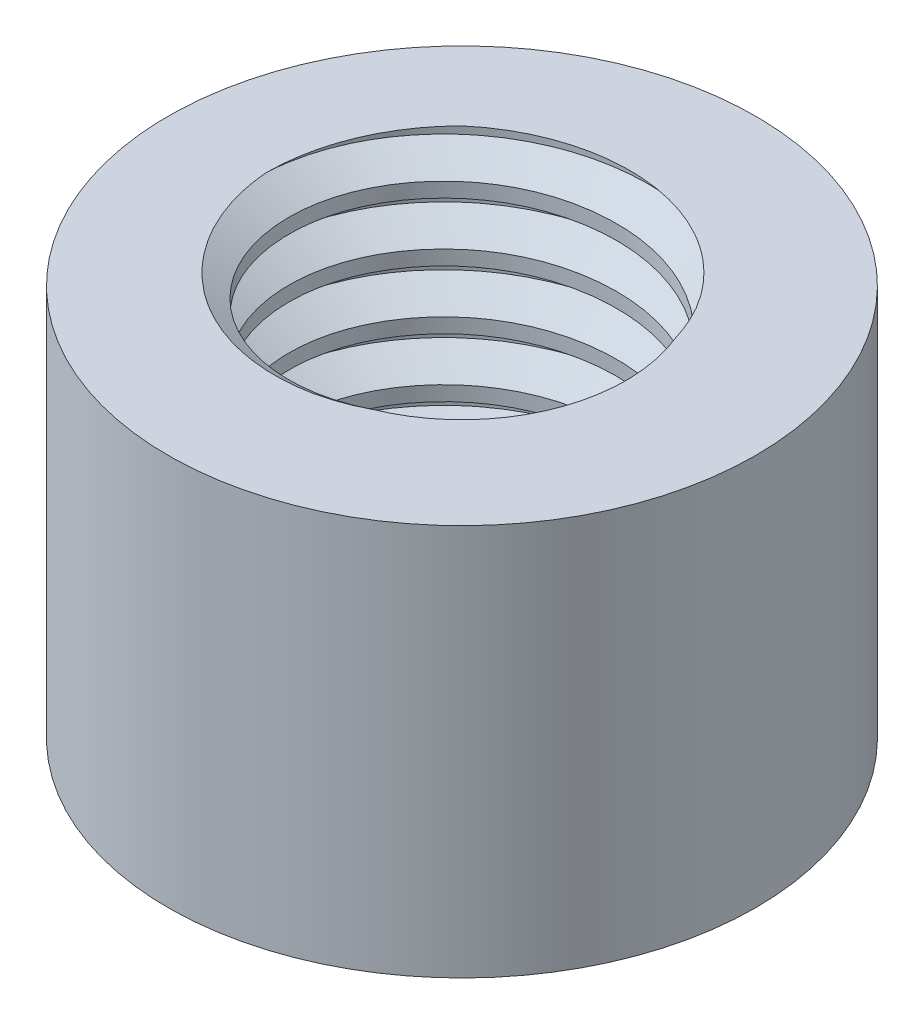
from build123d import *

# Parameters (mm, degrees)
ROSCA1_PITCH            = 1.5
CROQUIS5_R              = 7.5
CORTAR_EXTRUIR1_DEPTH   = 10
SALIENTE_EXTRUIR1_DEPTH = 2


with BuildPart() as part:
    # Croquis1 → Revolución1 (revolve)
    with BuildSketch(Plane.XY, mode=Mode.PRIVATE) as revoluci_n1_sk:
        Polygon((-5, 0), (-7.5, 0), (-7.5, -5), (-7.5, -10), (0, -10), (0, -8), (-5, -8), align=None)
    revolve(revoluci_n1_sk.sketch.rotate(Axis((0, -10, 0), (0, 1, 0)), 180), axis=Axis((0, -10, 0), (0, 1, 0)))

    # Rosca1: the profile of Perfil de rosca1 profile screwed along a right-hand helix of 6.333333 turns, 8 arcs to a turn; built about Z, then put on its axis
    rosca1_z = Axis((0, 0, 0), (0, 0, 1))
    rosca1_corners = [(5.0003, 0, -0.000173205), (5.0003, 0, 1.312673201), (4.188101187, 0, 0.843749998), (4.188101187, 0, 0.468749998)]
    with BuildLine(mode=Mode.PRIVATE) as rosca1_profile:
        Line(rosca1_corners[0], rosca1_corners[1])
        Line(rosca1_corners[1], rosca1_corners[2])
        Line(rosca1_corners[2], rosca1_corners[3])
        Line(rosca1_corners[3], rosca1_corners[0])
    rosca1_cap = Face(rosca1_profile.wire())
    rosca1_turn_angles = [0, 22.5, 45, 67.5, 90, 112.5, 135, 157.5, 180, 202.5, 225, 247.5, 270, 292.5, 315, 337.5, 360]
    rosca1_turn_weights = [1, 0.9238795325112867, 1, 0.9238795325112867, 1, 0.9238795325112867, 1, 0.9238795325112867, 1, 0.9238795325112867, 1, 0.9238795325112867, 1, 0.9238795325112867, 1, 0.9238795325112867, 1]
    rosca1_turn_rails = [Edge.make_bspline([Vector(p[0], p[1], 0).rotate(rosca1_z, rosca1_turn_angles[k]) / rosca1_turn_weights[k] + Vector(0, 0, p[2] + ROSCA1_PITCH * rosca1_turn_angles[k] / 360) for k in range(17)], [0, 0, 0, 1, 1, 2, 2, 3, 3, 4, 4, 5, 5, 6, 6, 7, 7, 8, 8, 8], 2, rosca1_turn_weights) for p in rosca1_corners]
    rosca1_turn_sides = [Face.make_surface_from_curves(rosca1_turn_rails[p[0]], rosca1_turn_rails[p[1]]) for p in [(0, 1), (1, 2), (2, 3), (3, 0)]]
    rosca1_last_angles = [2160, 2182.5, 2205, 2227.5, 2250, 2265, 2280]
    rosca1_last_weights = [1, 0.9238795325112867, 1, 0.9238795325112867, 1, 0.9659258262890714, 1]
    rosca1_last_rails = [Edge.make_bspline([Vector(p[0], p[1], 0).rotate(rosca1_z, rosca1_last_angles[k]) / rosca1_last_weights[k] + Vector(0, 0, p[2] + ROSCA1_PITCH * rosca1_last_angles[k] / 360) for k in range(7)], [0, 0, 0, 1, 1, 2, 2, 3, 3, 3], 2, rosca1_last_weights) for p in rosca1_corners]
    rosca1_last_sides = [Face.make_surface_from_curves(rosca1_last_rails[p[0]], rosca1_last_rails[p[1]]) for p in [(0, 1), (1, 2), (2, 3), (3, 0)]]
    rosca1 = Plane(origin=(0, 1.5, 0), x_dir=(-1, 0, 0), z_dir=(0, -1, 0)) * Solid(Shell([*[p.moved(Location((0, 0, ROSCA1_PITCH * i))) for i in range(6) for p in rosca1_turn_sides], *rosca1_last_sides, rosca1_cap, rosca1_cap.rotate(rosca1_z, 2280).moved(Location((0, 0, ROSCA1_PITCH * 2280 / 360)))]))
    add(rosca1)

    # Croquis5 → Cortar-Extruir1 (cut)
    with BuildSketch(Plane(origin=(0, 0, 0), x_dir=(1, 0, 0), z_dir=(0, 1, 0))):
        Circle(CROQUIS5_R)
    extrude(amount=CORTAR_EXTRUIR1_DEPTH, mode=Mode.SUBTRACT)

    # Croquis4 → Saliente-Extruir1 (add)
    # profile 1 of 3: a face of its own
    with BuildSketch(Plane.XZ.offset(8)):
        with BuildLine():
            add(Edge.make_bspline(
                [(5.478251921, -3.002627178), (5.29390043, -3.099654278), (4.905928354, -2.884281882), (4.501376727, -2.785808896), (4.196909906, -2.677109789), (3.967746952, -2.596816805), (3.760339535, -2.582999575), (3.585993776, -2.579520243), (3.441930866, -2.749462512), (2.780665747, -3.174491487), (0.84891506, -3.958631309), (-1.731438128, -3.299476192), (-3.14295018, -1.604521485), (-4.120441453, 0.120175448), (-4.806778409, 1.614644178), (-5.299672689, 2.581173013)],
                knots=[0, 0, 0, 0, 0.045509031, 0.074889424, 0.092461381, 0.113663555, 0.12569481, 0.137175213, 0.14804311, 0.170270934, 0.305000949, 0.581101451, 0.650983707, 0.770099509, 1, 1, 1, 1], degree=3))
            add(Edge.make_bspline(
                [(-5.299672689, 2.581173013), (-4.615732768, 2.716237164), (-3.265011851, 2.754011185), (-0.530490799, 2.720991239), (2.287611791, 1.54730746), (3.68359082, -0.65985297), (4.027793562, -1.719144185), (3.897343367, -2.24708248), (4.101924802, -2.302858997), (4.282500388, -2.386476967), (4.559218265, -2.475648125), (4.9566792, -2.617478505), (5.50575564, -2.704670228), (5.478251921, -3.002627178)],
                knots=[0, 0, 0, 0, 0.154784951, 0.300688181, 0.611266062, 0.783841375, 0.856255033, 0.872092857, 0.881127578, 0.897547223, 0.918952342, 0.943746115, 1, 1, 1, 1], degree=3))
        make_face()
        with BuildLine():
            Line((3.501943469, -1.963738888), (2.806699504, -1.746883796))
            add(Edge.make_bspline(
                [(2.758751644, 0.063147905), (2.711784764, -0.260993476), (2.788194051, -0.863427479), (2.764738323, -1.46857617), (2.806699504, -1.746883796)],
                knots=[0, 0, 0, 0, 0.536589435, 1, 1, 1, 1], degree=3))
            add(Edge.make_bspline(
                [(3.501943469, -1.963738888), (3.544770354, -1.67402202), (3.479047395, -1.233849135), (3.167578768, -0.565338884), (2.926648789, -0.190216633), (2.758751644, 0.063147905)],
                knots=[0, 0, 0, 0, 0.395874286, 0.586576357, 1, 1, 1, 1], degree=3))
        make_face(mode=Mode.SUBTRACT)
        with BuildLine():
            add(Edge.make_bspline(
                [(3.197402382, -2.435214612), (2.968736749, -2.704477653), (2.311957293, -3.001367046), (1.637294996, -3.249592229), (1.259577413, -3.236522878)],
                knots=[0, 0, 0, 0, 0.481114359, 1, 1, 1, 1], degree=3))
            add(Edge.make_bspline(
                [(2.792667099, -2.254640409), (2.624098806, -2.349703444), (2.385622108, -2.536713617), (1.849963251, -2.825258305), (1.469683649, -3.004839382), (1.259577413, -3.236522878)],
                knots=[0, 0, 0, 0, 0.317739101, 0.494985422, 1, 1, 1, 1], degree=3))
            Line((2.792667099, -2.254640409), (3.197402382, -2.435214612))
        make_face(mode=Mode.SUBTRACT)
        with BuildLine():
            add(Edge.make_bspline(
                [(2.332625336, -2.057359371), (2.204444092, -2.237750259), (1.908981692, -2.419240301), (1.501054271, -2.70593187), (1.075563329, -2.900327886), (0.830287167, -3.135814987), (0.657435515, -3.20047928)],
                knots=[0, 0, 0, 0, 0.316444487, 0.507915907, 0.734242178, 1, 1, 1, 1], degree=3))
            add(Edge.make_bspline(
                [(0.657435515, -3.20047928), (0.275019141, -3.281893265), (-0.122446389, -3.21645441), (-0.487956601, -3.094647063)],
                knots=[0, 0, 0, 0, 1, 1, 1, 1], degree=3))
            add(Edge.make_bspline(
                [(-0.487956601, -3.094647063), (-0.311841775, -2.909420999), (0.012112243, -2.655680867), (0.488030817, -2.329600161), (0.931290816, -2.044883182), (1.21680585, -1.805420721), (1.393575168, -1.702159119)],
                knots=[0, 0, 0, 0, 0.326234019, 0.524999997, 0.738479425, 1, 1, 1, 1], degree=3))
            add(Edge.make_bspline(
                [(2.332625336, -2.057359371), (2.171179591, -2.016939858), (1.861263246, -1.889311075), (1.552649438, -1.759644974), (1.393575168, -1.702159119)],
                knots=[0, 0, 0, 0, 0.495129296, 1, 1, 1, 1], degree=3))
        make_face(mode=Mode.SUBTRACT)
        with BuildLine():
            add(Edge.make_bspline(
                [(2.446306348, -1.467932866), (2.160175002, -1.385822633), (1.885149078, -1.269932675), (1.614931846, -1.146193508)],
                knots=[0, 0, 0, 0, 1, 1, 1, 1], degree=3))
            add(Edge.make_bspline(
                [(1.614931846, -1.146193508), (1.621068886, -0.820351844), (1.484452096, -0.314447891), (1.441131257, 0.480823724), (1.380601066, 0.950318327), (1.393575168, 1.226956)],
                knots=[0, 0, 0, 0, 0.405945984, 0.652935856, 1, 1, 1, 1], degree=3))
            add(Edge.make_bspline(
                [(2.332625336, 0.372416264), (2.293992565, 0.553201885), (2.091301766, 0.742095018), (1.793348205, 1.066435187), (1.531018304, 1.147424255), (1.393575168, 1.226956)],
                knots=[0, 0, 0, 0, 0.397172812, 0.631474775, 1, 1, 1, 1], degree=3))
            add(Edge.make_bspline(
                [(2.446306348, -1.467932866), (2.42971673, -1.196917742), (2.400748601, -0.582959081), (2.363711139, 0.030640418), (2.332625336, 0.372416264)],
                knots=[0, 0, 0, 0, 0.44173337, 1, 1, 1, 1], degree=3))
        make_face(mode=Mode.SUBTRACT)
        with BuildLine():
            add(Edge.make_bspline(
                [(0.894235683, -1.467932866), (0.693700668, -1.625183301), (0.352182984, -1.879664067), (-0.072199287, -2.246390825), (-0.521686018, -2.488609457), (-0.7478475, -2.745156951), (-0.916112577, -2.857973234)],
                knots=[0, 0, 0, 0, 0.33454946, 0.559859208, 0.734193862, 1, 1, 1, 1], degree=3))
            add(Edge.make_bspline(
                [(-0.916112577, -2.857973234), (-1.139922913, -2.847400378), (-1.425096366, -2.606537003), (-1.763759615, -2.455542177), (-1.873559432, -2.337916092)],
                knots=[0, 0, 0, 0, 0.568617713, 1, 1, 1, 1], degree=3))
            add(Edge.make_bspline(
                [(-1.873559432, -2.337916092), (-1.703076272, -2.169648407), (-1.20044956, -1.613342955), (-0.553071122, -1.216932424), (-0.208391607, -0.842711136)],
                knots=[0, 0, 0, 0, 0.321357801, 1, 1, 1, 1], degree=3))
            add(Edge.make_bspline(
                [(0.894235683, -1.467932866), (0.716233223, -1.36438606), (0.30372745, -1.237101052), (-0.023137138, -0.954404207), (-0.208391607, -0.842711136)],
                knots=[0, 0, 0, 0, 0.486655124, 1, 1, 1, 1], degree=3))
        make_face(mode=Mode.SUBTRACT)
        with BuildLine():
            add(Edge.make_bspline(
                [(-0.736608479, -0.612512132), (-0.83737925, -0.8429299), (-1.142908694, -1.093011337), (-1.704085469, -1.501329446), (-1.937074732, -1.906326717), (-2.2092938, -2.057359371)],
                knots=[0, 0, 0, 0, 0.35060217, 0.56402103, 1, 1, 1, 1], degree=3))
            add(Edge.make_bspline(
                [(-2.2092938, -2.057359371), (-2.412845621, -1.924711374), (-2.608290812, -1.539268727), (-2.906394563, -1.232926401), (-3.006998349, -1.068531412)],
                knots=[0, 0, 0, 0, 0.548238925, 1, 1, 1, 1], degree=3))
            add(Edge.make_bspline(
                [(-3.006998349, -1.068531412), (-2.776596409, -0.921205781), (-2.453035519, -0.713833474), (-1.997445907, -0.366536647), (-1.725699875, -0.230938058), (-1.595674916, -0.090888412)],
                knots=[0, 0, 0, 0, 0.477747976, 0.669719662, 1, 1, 1, 1], degree=3))
            add(Edge.make_bspline(
                [(-0.736608479, -0.612512132), (-0.998680748, -0.395875208), (-1.349073817, -0.329301695), (-1.595674916, -0.090888412)],
                knots=[0, 0, 0, 0, 1, 1, 1, 1], degree=3))
        make_face(mode=Mode.SUBTRACT)
        with BuildLine():
            add(Edge.make_bspline(
                [(-3.194809653, -0.751762071), (-2.965312201, -0.52626626), (-2.521872548, -0.351028703), (-2.083739495, -0.043196962), (-2.021812124, 0.140440683)],
                knots=[0, 0, 0, 0, 0.616736789, 1, 1, 1, 1], degree=3))
            add(Edge.make_bspline(
                [(-2.021812124, 0.140440683), (-2.350408456, 0.458763469), (-2.823922379, 0.540185753), (-3.144991226, 0.869169882)],
                knots=[0, 0, 0, 0, 1, 1, 1, 1], degree=3))
            add(Edge.make_bspline(
                [(-3.8786808, 0.498227574), (-3.59028248, 0.523038175), (-3.450031178, 0.943460313), (-3.144991226, 0.869169882)],
                knots=[0, 0, 0, 0, 1, 1, 1, 1], degree=3))
            add(Edge.make_bspline(
                [(-3.194809653, -0.751762071), (-3.387908289, -0.532806012), (-3.515070983, -0.063874745), (-3.791986348, 0.32769372), (-3.8786808, 0.498227574)],
                knots=[0, 0, 0, 0, 0.597561688, 1, 1, 1, 1], degree=3))
        make_face(mode=Mode.SUBTRACT)
        with BuildLine():
            add(Edge.make_bspline(
                [(-3.548067597, 1.147164639), (-3.643824206, 1.109802317), (-3.925940599, 0.726353745), (-4.167660365, 1.012591638), (-4.332048959, 1.370797362), (-4.510588136, 1.696099048), (-4.630486166, 1.924846191)],
                knots=[0, 0, 0, 0, 0.310867916, 0.394957503, 0.558356504, 1, 1, 1, 1], degree=3))
            add(Edge.make_bspline(
                [(-3.548067597, 1.147164639), (-3.697235715, 1.287648094), (-4.047670084, 1.562171511), (-4.400928694, 1.839442536), (-4.630486166, 1.924846191)],
                knots=[0, 0, 0, 0, 0.458358468, 1, 1, 1, 1], degree=3))
        make_face(mode=Mode.SUBTRACT)
        with BuildLine():
            add(Edge.make_bspline(
                [(-3.457488637, 1.698398791), (-3.444614185, 1.869649804), (-3.467543771, 2.038666228), (-3.448019918, 2.387247155), (-3.652377855, 2.38184248), (-3.828843876, 2.423075618), (-4.150172475, 2.386788056), (-4.392526111, 2.473823769), (-4.562551946, 2.418501521)],
                knots=[0, 0, 0, 0, 0.268264531, 0.385213078, 0.459278609, 0.566833805, 0.712658108, 1, 1, 1, 1], degree=3))
            add(Edge.make_bspline(
                [(-3.457488637, 1.698398791), (-3.662587569, 1.821728169), (-4.043372356, 2.044851742), (-4.380401593, 2.330688851), (-4.562551946, 2.418501521)],
                knots=[0, 0, 0, 0, 0.544609427, 1, 1, 1, 1], degree=3))
        make_face(mode=Mode.SUBTRACT)
        with BuildLine():
            add(Edge.make_bspline(
                [(-1.907130483, 0.709290217), (-2.136760904, 0.783369598), (-2.37607623, 1.040076469), (-2.814646657, 1.169325129), (-2.957256222, 1.473391315), (-3.018250983, 1.858057874), (-3.061615005, 2.172816098), (-3.061633453, 2.364154146)],
                knots=[0, 0, 0, 0, 0.312979463, 0.470055147, 0.574113789, 0.74198976, 1, 1, 1, 1], degree=3))
            add(Edge.make_bspline(
                [(-1.907130483, 0.709290217), (-2.002273826, 0.979492376), (-1.956855694, 1.376213483), (-2.108774276, 1.859666668), (-2.201904226, 2.104198645), (-2.244093622, 2.336876129), (-2.590704454, 2.407308877), (-2.826026799, 2.328087179), (-3.061633453, 2.364154146)],
                knots=[0, 0, 0, 0, 0.341457352, 0.475560879, 0.607155055, 0.678259428, 0.727850671, 1, 1, 1, 1], degree=3))
        make_face(mode=Mode.SUBTRACT)
        with BuildLine():
            add(Edge.make_bspline(
                [(-0.674888062, 0), (-0.85732761, 0.09940098), (-1.099407772, 0.203756829), (-1.38895256, 0.400738698), (-1.524316253, 0.672267206), (-1.613018828, 1.035791762), (-1.599284284, 1.614779227), (-1.827175427, 1.993900555), (-1.827974048, 2.273575186)],
                knots=[0, 0, 0, 0, 0.225465408, 0.29156805, 0.375328035, 0.547817357, 0.698545178, 1, 1, 1, 1], degree=3))
            add(Edge.make_bspline(
                [(-0.674888062, 0), (-0.675799539, 0.274855721), (-0.846109586, 0.667111782), (-0.865488367, 1.215453568), (-0.955115287, 1.620633189), (-0.995526171, 1.917587682), (-1.025186834, 2.21424959), (-1.412312681, 2.233997717), (-1.61491931, 2.313651929), (-1.827974048, 2.273575186)],
                knots=[0, 0, 0, 0, 0.271622479, 0.416102507, 0.548394434, 0.680552673, 0.734695834, 0.811446838, 1, 1, 1, 1], degree=3))
        make_face(mode=Mode.SUBTRACT)
        with BuildLine():
            add(Edge.make_bspline(
                [(1.113018447, -0.842711136), (0.902986366, -0.771299419), (0.545542086, -0.681466915), (0.162774294, -0.410413541), (-0.161026202, -0.321463945), (-0.340732039, 0.032997421), (-0.327758733, 0.475783289), (-0.511246011, 1.163479188), (-0.470819364, 1.681880904), (-0.570823542, 2.008649708)],
                knots=[0, 0, 0, 0, 0.180624549, 0.286973248, 0.379070055, 0.431350089, 0.590975992, 0.729093622, 1, 1, 1, 1], degree=3))
            add(Edge.make_bspline(
                [(1.113018447, -0.842711136), (1.125220159, -0.559408194), (1.07116388, -0.116672573), (1.019250714, 0.53792248), (0.905013545, 1.021884086), (0.992410032, 1.508684179), (0.68271966, 1.695417146), (0.396403919, 1.804163172), (-0.049296099, 1.896509595), (-0.352746042, 2.061695928), (-0.570823542, 2.008649708)],
                knots=[0, 0, 0, 0, 0.213489292, 0.340134324, 0.492638803, 0.605070801, 0.657073496, 0.74688571, 0.84183989, 1, 1, 1, 1], degree=3))
        make_face(mode=Mode.SUBTRACT)
    # profile 2 of 3: a face of its own
    with BuildSketch(Plane.XZ.offset(8)):
        Polygon((4.345748114, -0.974781748), (6.452582237, -0.974781748), (6.452582237, 0.181006336), (6.749223114, 0.181006336), (6.749223114, -1.475309798), (4.345748114, -1.475309798), align=None)
    # profile 3 of 3: a face of its own
    with BuildSketch(Plane.XZ.offset(8)):
        Polygon((4.345748114, 0.994845284), (6.452582237, 0.994845284), (6.452582237, 2.150633368), (6.749223114, 2.150633368), (6.749223114, 0.494317234), (4.345748114, 0.494317234), align=None)
    extrude(amount=SALIENTE_EXTRUIR1_DEPTH)


solid = part.part
